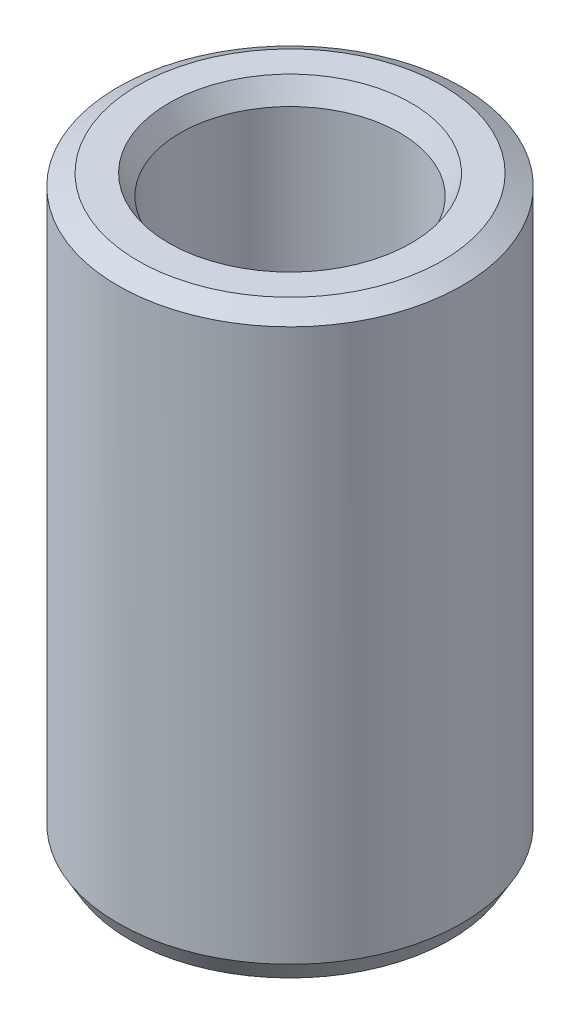
from build123d import *
from OCP.BRepFilletAPI import BRepFilletAPI_MakeChamfer

# Parameters (mm, degrees)
SKETCH1_R           = 25
BOSS_EXTRUDE1_DEPTH = 84.804382632
SKETCH2_R           = 15.947622599
CUT_EXTRUDE1_DEPTH  = 92.879177802
CHAMFER1_SIZE       = 1.675330722
CHAMFER1_SIZE2      = 2.90175793


with BuildPart() as part:
    # Sketch1 → Boss-Extrude1 (new body)
    with BuildSketch(Plane(origin=(0, 0, 0), x_dir=(1, 0, 0), z_dir=(0, 1, 0))):
        Circle(SKETCH1_R)
    extrude(amount=BOSS_EXTRUDE1_DEPTH)

    # Sketch2 → Cut-Extrude1 (cut, through all)
    with BuildSketch(Plane(origin=(0, 0, 0), x_dir=(1, 0, 0), z_dir=(0, 1, 0))):
        Circle(SKETCH2_R)
    extrude(amount=CUT_EXTRUDE1_DEPTH, mode=Mode.SUBTRACT)

    # Chamfer1: one chamfer whose edges measure the first distance from different faces: ONE call of the kernel's chamfer builder (chamfer() names one face for all edges)
    chamfer1_edges_1 = [part.edges().sort_by_distance(p)[0] for p in [
        (-15.947622599, 84.804382632, 0),
    ]]
    chamfer1_side_1 = [part.faces().sort_by_distance(p)[0] for p in [
        (-24.292893219, 84.804382632, 0),
    ]]
    chamfer1_edges_2 = [part.edges().sort_by_distance(p)[0] for p in [
        (-15.947622599, 0, 0),
    ]]
    chamfer1_side_2 = [part.faces().sort_by_distance(p)[0] for p in [
        (-15.947622599, 42.402191316, 0),
    ]]
    chamfer1_edges_3 = [part.edges().sort_by_distance(p)[0] for p in [
        (-25, 0, 0),
    ]]
    chamfer1_side_3 = [part.faces().sort_by_distance(p)[0] for p in [
        (-24.292893219, 0, 0),
    ]]
    chamfer1_edges_4 = [part.edges().sort_by_distance(p)[0] for p in [
        (-25, 84.804382632, 0),
    ]]
    chamfer1_side_4 = [part.faces().sort_by_distance(p)[0] for p in [
        (-25, 42.402191316, 0),
    ]]
    chamfer1 = BRepFilletAPI_MakeChamfer(part.part.solid().wrapped)
    for e in chamfer1_edges_1:
        chamfer1.Add(CHAMFER1_SIZE, CHAMFER1_SIZE2, e.wrapped, chamfer1_side_1[0].wrapped)  # the first distance lies on this face
    for e in chamfer1_edges_2:
        chamfer1.Add(CHAMFER1_SIZE, CHAMFER1_SIZE2, e.wrapped, chamfer1_side_2[0].wrapped)  # the first distance lies on this face
    for e in chamfer1_edges_3:
        chamfer1.Add(CHAMFER1_SIZE, CHAMFER1_SIZE2, e.wrapped, chamfer1_side_3[0].wrapped)  # the first distance lies on this face
    for e in chamfer1_edges_4:
        chamfer1.Add(CHAMFER1_SIZE, CHAMFER1_SIZE2, e.wrapped, chamfer1_side_4[0].wrapped)  # the first distance lies on this face
    add(Compound.cast(chamfer1.Shape()), mode=Mode.REPLACE)


solid = part.part
